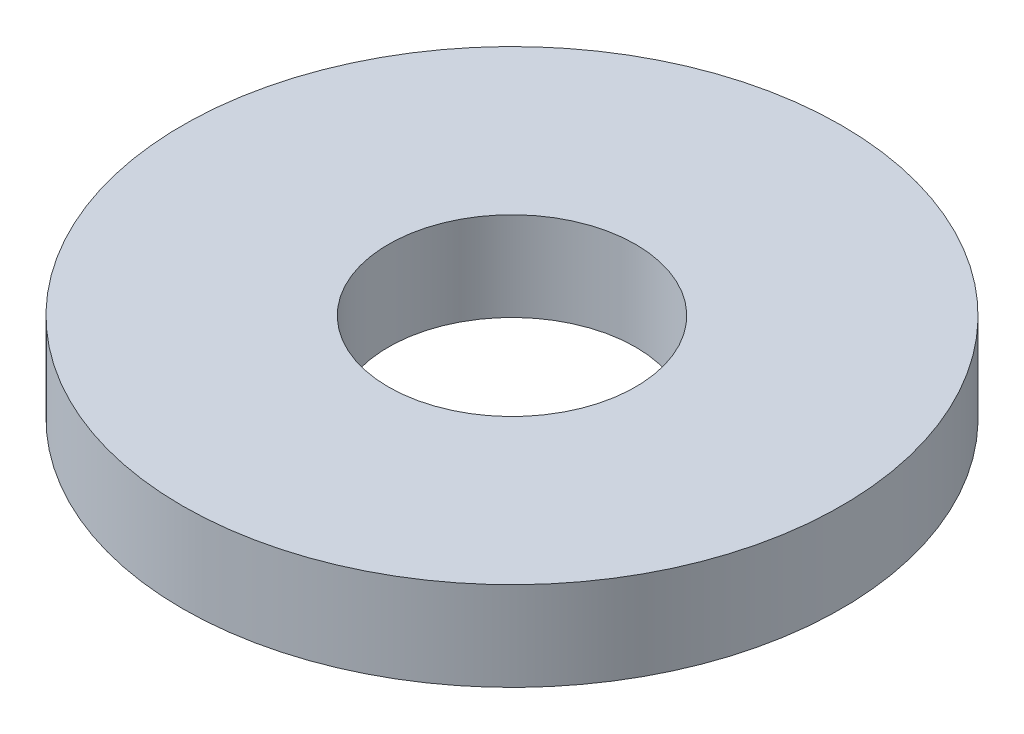
from build123d import *

# Parameters (mm, degrees)
SKETCH1_R           = 100
BOSS_EXTRUDE1_DEPTH = 27
SKETCH2_R           = 37.5
CUT_EXTRUDE1_DEPTH  = 144.975692393


with BuildPart() as part:
    # Sketch1 → Boss-Extrude1 (new body)
    with BuildSketch(Plane(origin=(0, 0, 0), x_dir=(1, 0, 0), z_dir=(0, 1, 0))):
        Circle(SKETCH1_R)
    extrude(amount=BOSS_EXTRUDE1_DEPTH)

    # Sketch2 → Cut-Extrude1 (cut, through all)
    with BuildSketch(Plane(origin=(0, 0, 0), x_dir=(1, 0, 0), z_dir=(0, 1, 0))):
        Circle(SKETCH2_R)
    extrude(amount=CUT_EXTRUDE1_DEPTH, mode=Mode.SUBTRACT)


solid = part.part
